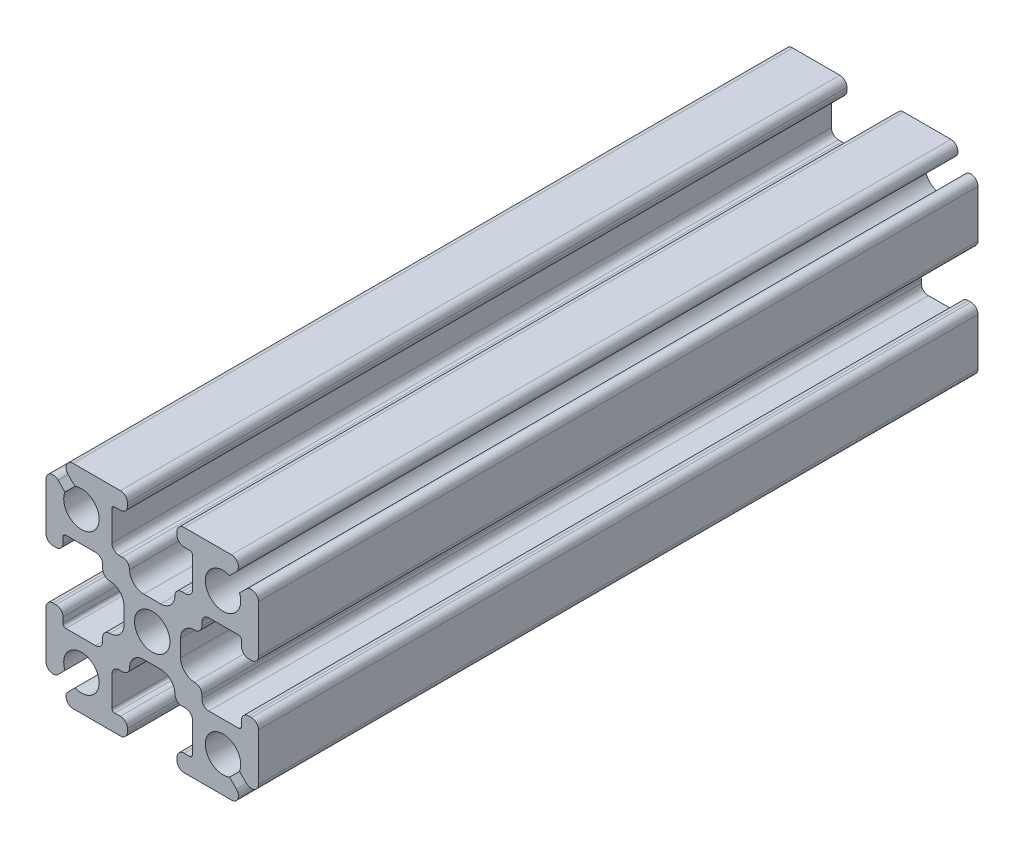
from build123d import *

# Parameters (mm, degrees)
SKETCH1_R           = 1.25
BOSS_EXTRUDE1_DEPTH = 50.8


with BuildPart() as part:
    # Sketch1 → Boss-Extrude1 (new body)
    with BuildSketch(Plane.XY):
        with BuildLine():
            Line((6.646446609, 5.939339828), (6.163645978, 5.456539197))
            ThreePointArc((6.163645978, 5.456539197), (4.116116524, 4.116116524), (5.456539197, 6.163645978))
            Line((5.456539197, 6.163645978), (5.939339828, 6.646446609))
            ThreePointArc((5.939339828, 6.646446609), (6.047726204, 7.191341716), (5.585786438, 7.5))
            Line((5.585786438, 7.5), (2.25, 7.5))
            ThreePointArc((2.25, 7.5), (1.896446609, 7.353553391), (1.75, 7))
            Line((1.75, 7), (1.75, 6.8))
            ThreePointArc((1.75, 6.8), (1.896446609, 6.446446609), (2.25, 6.3))
            Line((2.25, 6.3), (2.65, 6.3))
            ThreePointArc((2.65, 6.3), (2.791421356, 6.241421356), (2.85, 6.1))
            Line((2.85, 6.1), (2.85, 4))
            ThreePointArc((2.85, 4), (2.703553391, 3.646446609), (2.35, 3.5))
            Line((2.35, 3.5), (2.1, 3.5))
            ThreePointArc((2.1, 3.5), (1.746446609, 3.353553391), (1.6, 3))
            ThreePointArc((1.6, 3), (1.307106781, 2.292893219), (0.6, 2))
            Line((0.6, 2), (-0.6, 2))
            ThreePointArc((-0.6, 2), (-1.307106781, 2.292893219), (-1.6, 3))
            ThreePointArc((-1.6, 3), (-1.746446609, 3.353553391), (-2.1, 3.5))
            Line((-2.1, 3.5), (-2.35, 3.5))
            ThreePointArc((-2.35, 3.5), (-2.703553391, 3.646446609), (-2.85, 4))
            Line((-2.85, 4), (-2.85, 6.1))
            ThreePointArc((-2.85, 6.1), (-2.791421356, 6.241421356), (-2.65, 6.3))
            Line((-2.65, 6.3), (-2.25, 6.3))
            ThreePointArc((-2.25, 6.3), (-1.896446609, 6.446446609), (-1.75, 6.8))
            Line((-1.75, 6.8), (-1.75, 7))
            ThreePointArc((-1.75, 7), (-1.896446609, 7.353553391), (-2.25, 7.5))
            Line((-2.25, 7.5), (-5.585786438, 7.5))
            ThreePointArc((-5.585786438, 7.5), (-6.047726204, 7.191341716), (-5.939339828, 6.646446609))
            Line((-5.939339828, 6.646446609), (-5.456539197, 6.163645978))
            ThreePointArc((-5.456539197, 6.163645978), (-4.116116524, 4.116116524), (-6.163645978, 5.456539197))
            Line((-6.163645978, 5.456539197), (-6.646446609, 5.939339828))
            ThreePointArc((-6.646446609, 5.939339828), (-7.191341716, 6.047726204), (-7.5, 5.585786438))
            Line((-7.5, 5.585786438), (-7.5, 2.25))
            ThreePointArc((-7.5, 2.25), (-7.353553391, 1.896446609), (-7, 1.75))
            Line((-7, 1.75), (-6.8, 1.75))
            ThreePointArc((-6.8, 1.75), (-6.446446609, 1.896446609), (-6.3, 2.25))
            Line((-6.3, 2.25), (-6.3, 2.65))
            ThreePointArc((-6.3, 2.65), (-6.241421356, 2.791421356), (-6.1, 2.85))
            Line((-6.1, 2.85), (-4, 2.85))
            ThreePointArc((-4, 2.85), (-3.646446609, 2.703553391), (-3.5, 2.35))
            Line((-3.5, 2.35), (-3.5, 2.1))
            ThreePointArc((-3.5, 2.1), (-3.353553391, 1.746446609), (-3, 1.6))
            ThreePointArc((-3, 1.6), (-2.292893219, 1.307106781), (-2, 0.6))
            Line((-2, 0.6), (-2, -0.6))
            ThreePointArc((-2, -0.6), (-2.292893219, -1.307106781), (-3, -1.6))
            ThreePointArc((-3, -1.6), (-3.353553391, -1.746446609), (-3.5, -2.1))
            Line((-3.5, -2.1), (-3.5, -2.35))
            ThreePointArc((-3.5, -2.35), (-3.646446609, -2.703553391), (-4, -2.85))
            Line((-4, -2.85), (-6.1, -2.85))
            ThreePointArc((-6.1, -2.85), (-6.241421356, -2.791421356), (-6.3, -2.65))
            Line((-6.3, -2.65), (-6.3, -2.25))
            ThreePointArc((-6.3, -2.25), (-6.446446609, -1.896446609), (-6.8, -1.75))
            Line((-6.8, -1.75), (-7, -1.75))
            ThreePointArc((-7, -1.75), (-7.353553391, -1.896446609), (-7.5, -2.25))
            Line((-7.5, -2.25), (-7.5, -5.585786438))
            ThreePointArc((-7.5, -5.585786438), (-7.191341716, -6.047726204), (-6.646446609, -5.939339828))
            Line((-6.646446609, -5.939339828), (-6.163645978, -5.456539197))
            ThreePointArc((-6.163645978, -5.456539197), (-4.116116524, -4.116116524), (-5.456539197, -6.163645978))
            Line((-5.456539197, -6.163645978), (-5.939339828, -6.646446609))
            ThreePointArc((-5.939339828, -6.646446609), (-6.047726204, -7.191341716), (-5.585786438, -7.5))
            Line((-5.585786438, -7.5), (-2.25, -7.5))
            ThreePointArc((-2.25, -7.5), (-1.896446609, -7.353553391), (-1.75, -7))
            Line((-1.75, -7), (-1.75, -6.8))
            ThreePointArc((-1.75, -6.8), (-1.896446609, -6.446446609), (-2.25, -6.3))
            Line((-2.25, -6.3), (-2.65, -6.3))
            ThreePointArc((-2.65, -6.3), (-2.791421356, -6.241421356), (-2.85, -6.1))
            Line((-2.85, -6.1), (-2.85, -4))
            ThreePointArc((-2.85, -4), (-2.703553391, -3.646446609), (-2.35, -3.5))
            Line((-2.35, -3.5), (-2.1, -3.5))
            ThreePointArc((-2.1, -3.5), (-1.746446609, -3.353553391), (-1.6, -3))
            ThreePointArc((-1.6, -3), (-1.307106781, -2.292893219), (-0.6, -2))
            Line((-0.6, -2), (0.6, -2))
            ThreePointArc((0.6, -2), (1.307106781, -2.292893219), (1.6, -3))
            ThreePointArc((1.6, -3), (1.746446609, -3.353553391), (2.1, -3.5))
            Line((2.1, -3.5), (2.35, -3.5))
            ThreePointArc((2.35, -3.5), (2.703553391, -3.646446609), (2.85, -4))
            Line((2.85, -4), (2.85, -6.1))
            ThreePointArc((2.85, -6.1), (2.791421356, -6.241421356), (2.65, -6.3))
            Line((2.65, -6.3), (2.25, -6.3))
            ThreePointArc((2.25, -6.3), (1.896446609, -6.446446609), (1.75, -6.8))
            Line((1.75, -6.8), (1.75, -7))
            ThreePointArc((1.75, -7), (1.896446609, -7.353553391), (2.25, -7.5))
            Line((2.25, -7.5), (5.585786438, -7.5))
            ThreePointArc((5.585786438, -7.5), (6.047726204, -7.191341716), (5.939339828, -6.646446609))
            Line((5.939339828, -6.646446609), (5.456539197, -6.163645978))
            ThreePointArc((5.456539197, -6.163645978), (4.116116524, -4.116116524), (6.163645978, -5.456539197))
            Line((6.163645978, -5.456539197), (6.646446609, -5.939339828))
            ThreePointArc((6.646446609, -5.939339828), (7.191341716, -6.047726204), (7.5, -5.585786438))
            Line((7.5, -5.585786438), (7.5, -2.25))
            ThreePointArc((7.5, -2.25), (7.353553391, -1.896446609), (7, -1.75))
            Line((7, -1.75), (6.8, -1.75))
            ThreePointArc((6.8, -1.75), (6.446446609, -1.896446609), (6.3, -2.25))
            Line((6.3, -2.25), (6.3, -2.65))
            ThreePointArc((6.3, -2.65), (6.241421356, -2.791421356), (6.1, -2.85))
            Line((6.1, -2.85), (4, -2.85))
            ThreePointArc((4, -2.85), (3.646446609, -2.703553391), (3.5, -2.35))
            Line((3.5, -2.35), (3.5, -2.1))
            ThreePointArc((3.5, -2.1), (3.353553391, -1.746446609), (3, -1.6))
            ThreePointArc((3, -1.6), (2.292893219, -1.307106781), (2, -0.6))
            Line((2, -0.6), (2, 0.6))
            ThreePointArc((2, 0.6), (2.292893219, 1.307106781), (3, 1.6))
            ThreePointArc((3, 1.6), (3.353553391, 1.746446609), (3.5, 2.1))
            Line((3.5, 2.1), (3.5, 2.35))
            ThreePointArc((3.5, 2.35), (3.646446609, 2.703553391), (4, 2.85))
            Line((4, 2.85), (6.1, 2.85))
            ThreePointArc((6.1, 2.85), (6.241421356, 2.791421356), (6.3, 2.65))
            Line((6.3, 2.65), (6.3, 2.25))
            ThreePointArc((6.3, 2.25), (6.446446609, 1.896446609), (6.8, 1.75))
            Line((6.8, 1.75), (7, 1.75))
            ThreePointArc((7, 1.75), (7.353553391, 1.896446609), (7.5, 2.25))
            Line((7.5, 2.25), (7.5, 5.585786438))
            ThreePointArc((7.5, 5.585786438), (7.191341716, 6.047726204), (6.646446609, 5.939339828))
        make_face()
        Circle(SKETCH1_R, mode=Mode.SUBTRACT)
    extrude(amount=BOSS_EXTRUDE1_DEPTH)


solid = part.part
